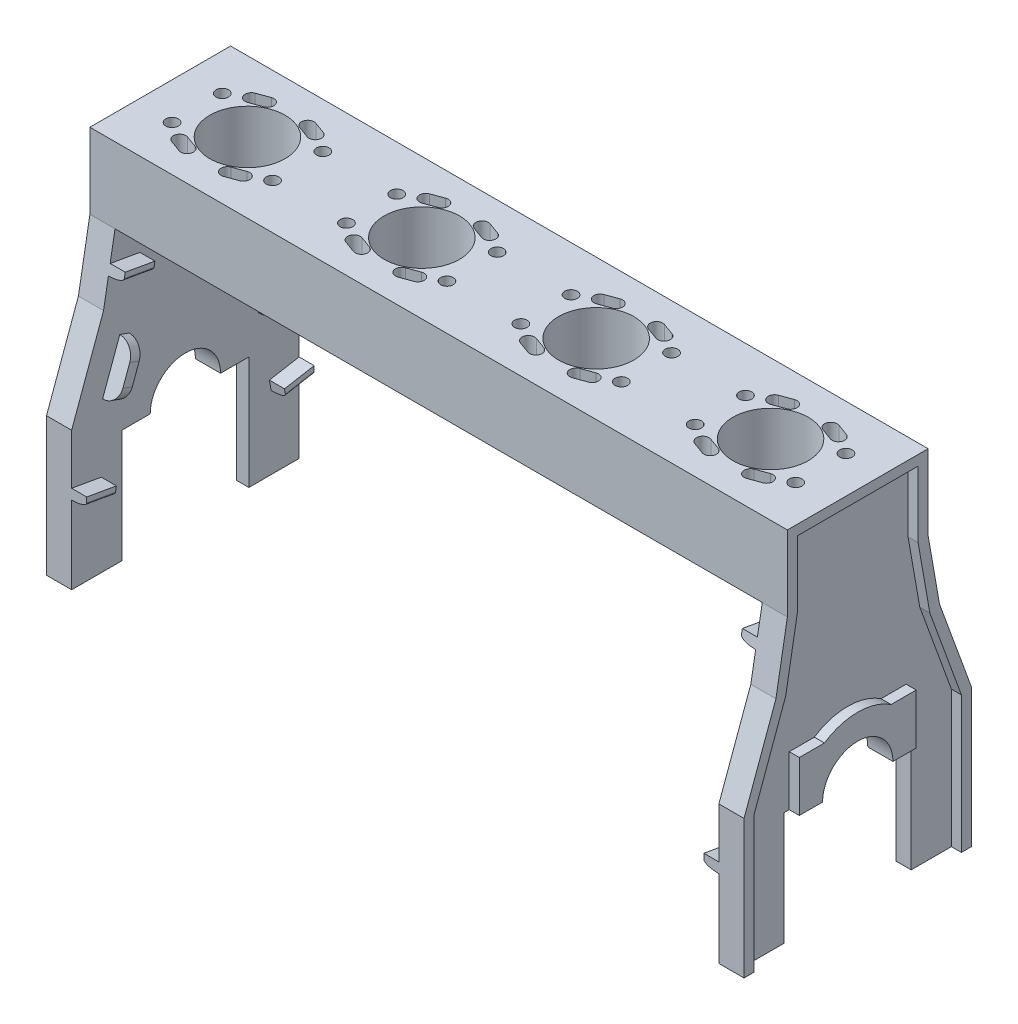
from build123d import *

# Parameters (mm, degrees)
SKETCH1_W           = 352.552
SKETCH1_H           = 71.12
SKETCH1_R           = 19.05
SKETCH1_R_2         = 3.175
BOSS_EXTRUDE1_DEPTH = 38.1
BOSS_EXTRUDE2_DEPTH = 12.7
CUT_EXTRUDE1_DEPTH  = 5.08
BOSS_EXTRUDE3_START = -12.7
BOSS_EXTRUDE3_DEPTH = 12.7
CUT_EXTRUDE4_START  = -6.35
CUT_EXTRUDE4_DEPTH  = 6.35
SKETCH7_R           = 3.175
CUT_EXTRUDE5_DEPTH  = 17.78
BOSS_EXTRUDE4_DEPTH = 7.62
BOSS_EXTRUDE5_DEPTH = 7.62
FILLET1_R           = 7.62
FILLET2_SIZE        = 7.62
FILLET2_SIZE_2      = 2.54


# Some blends are built 0.0001 mm under size
with BuildPart() as part:
    # Sketch1 → Boss-Extrude1 (new body)
    with BuildSketch(Plane(origin=(0, 0, 0), x_dir=(1, 0, 0), z_dir=(0, 1, 0))):
        with Locations((-132.207, 0)):
            Rectangle(SKETCH1_W, SKETCH1_H)
        with Locations(Location((0, 0, 0), (0, 0, 90))):
            Circle(SKETCH1_R, mode=Mode.SUBTRACT)
        with Locations(Location((-88.138, 0, 0), (0, 0, 90))):
            Circle(SKETCH1_R, mode=Mode.SUBTRACT)
        with Locations(Location((-176.276, 0, 0), (0, 0, 90))):
            Circle(SKETCH1_R, mode=Mode.SUBTRACT)
        with Locations(Location((-264.414, 0, 0), (0, 0, 90))):
            Circle(SKETCH1_R, mode=Mode.SUBTRACT)
        with Locations(Location((25.4, -12.7, 0), (0, 0, 90))):
            Circle(SKETCH1_R_2, mode=Mode.SUBTRACT)
        with Locations(Location((-25.4, -12.7, 0), (0, 0, 90))):
            Circle(SKETCH1_R_2, mode=Mode.SUBTRACT)
        with Locations(Location((25.4, 12.7, 0), (0, 0, 90))):
            Circle(SKETCH1_R_2, mode=Mode.SUBTRACT)
        with Locations(Location((-25.4, 12.7, 0), (0, 0, 90))):
            Circle(SKETCH1_R_2, mode=Mode.SUBTRACT)
        with Locations(Location((-113.538, 12.7, 0), (0, 0, 90))):
            Circle(SKETCH1_R_2, mode=Mode.SUBTRACT)
        with Locations(Location((-62.738, 12.7, 0), (0, 0, 90))):
            Circle(SKETCH1_R_2, mode=Mode.SUBTRACT)
        with Locations(Location((-113.538, -12.7, 0), (0, 0, 90))):
            Circle(SKETCH1_R_2, mode=Mode.SUBTRACT)
        with Locations(Location((-62.738, -12.7, 0), (0, 0, 90))):
            Circle(SKETCH1_R_2, mode=Mode.SUBTRACT)
        with Locations(Location((-201.676, 12.7, 0), (0, 0, 90))):
            Circle(SKETCH1_R_2, mode=Mode.SUBTRACT)
        with Locations(Location((-150.876, 12.7, 0), (0, 0, 90))):
            Circle(SKETCH1_R_2, mode=Mode.SUBTRACT)
        with Locations(Location((-201.676, -12.7, 0), (0, 0, 90))):
            Circle(SKETCH1_R_2, mode=Mode.SUBTRACT)
        with Locations(Location((-150.876, -12.7, 0), (0, 0, 90))):
            Circle(SKETCH1_R_2, mode=Mode.SUBTRACT)
        with Locations(Location((-289.814, 12.7, 0), (0, 0, 90))):
            Circle(SKETCH1_R_2, mode=Mode.SUBTRACT)
        with Locations(Location((-239.014, 12.7, 0), (0, 0, 90))):
            Circle(SKETCH1_R_2, mode=Mode.SUBTRACT)
        with Locations(Location((-289.814, -12.7, 0), (0, 0, 90))):
            Circle(SKETCH1_R_2, mode=Mode.SUBTRACT)
        with Locations(Location((-239.014, -12.7, 0), (0, 0, 90))):
            Circle(SKETCH1_R_2, mode=Mode.SUBTRACT)
        with BuildLine():
            Line((15.041134187, -15.164648019), (9.074086045, -17.336475929))
            ThreePointArc((9.074086045, -17.336475929), (7.176475929, -21.405913955), (11.245913955, -23.303524071))
            Line((11.245913955, -23.303524071), (17.212962097, -21.131696161))
            ThreePointArc((17.212962097, -21.131696161), (19.110572213, -17.062258135), (15.041134187, -15.164648019))
        make_face(mode=Mode.SUBTRACT)
        with BuildLine():
            Line((-17.212962097, -21.131696161), (-11.245913955, -23.303524071))
            ThreePointArc((-11.245913955, -23.303524071), (-7.176475929, -21.405913955), (-9.074086045, -17.336475929))
            Line((-9.074086045, -17.336475929), (-15.041134187, -15.164648019))
            ThreePointArc((-15.041134187, -15.164648019), (-19.110572213, -17.062258135), (-17.212962097, -21.131696161))
        make_face(mode=Mode.SUBTRACT)
        with BuildLine():
            Line((17.212962097, 21.131696161), (11.245913955, 23.303524071))
            ThreePointArc((11.245913955, 23.303524071), (7.176475929, 21.405913955), (9.074086045, 17.336475929))
            Line((9.074086045, 17.336475929), (15.041134187, 15.164648019))
            ThreePointArc((15.041134187, 15.164648019), (19.110572213, 17.062258135), (17.212962097, 21.131696161))
        make_face(mode=Mode.SUBTRACT)
        with BuildLine():
            Line((-15.041134187, 15.164648019), (-9.074086045, 17.336475929))
            ThreePointArc((-9.074086045, 17.336475929), (-7.176475929, 21.405913955), (-11.245913955, 23.303524071))
            Line((-11.245913955, 23.303524071), (-17.212962097, 21.131696161))
            ThreePointArc((-17.212962097, 21.131696161), (-19.110572213, 17.062258135), (-15.041134187, 15.164648019))
        make_face(mode=Mode.SUBTRACT)
        with BuildLine():
            Line((-103.179134187, 15.164648019), (-97.212086045, 17.336475929))
            ThreePointArc((-97.212086045, 17.336475929), (-95.314475929, 21.405913955), (-99.383913955, 23.303524071))
            Line((-99.383913955, 23.303524071), (-105.350962097, 21.131696161))
            ThreePointArc((-105.350962097, 21.131696161), (-107.248572213, 17.062258135), (-103.179134187, 15.164648019))
        make_face(mode=Mode.SUBTRACT)
        with BuildLine():
            Line((-70.925037903, 21.131696161), (-76.892086045, 23.303524071))
            ThreePointArc((-76.892086045, 23.303524071), (-80.961524071, 21.405913955), (-79.063913955, 17.336475929))
            Line((-79.063913955, 17.336475929), (-73.096865813, 15.164648019))
            ThreePointArc((-73.096865813, 15.164648019), (-69.027427787, 17.062258135), (-70.925037903, 21.131696161))
        make_face(mode=Mode.SUBTRACT)
        with BuildLine():
            Line((-105.350962097, -21.131696161), (-99.383913955, -23.303524071))
            ThreePointArc((-99.383913955, -23.303524071), (-95.314475929, -21.405913955), (-97.212086045, -17.336475929))
            Line((-97.212086045, -17.336475929), (-103.179134187, -15.164648019))
            ThreePointArc((-103.179134187, -15.164648019), (-107.248572213, -17.062258135), (-105.350962097, -21.131696161))
        make_face(mode=Mode.SUBTRACT)
        with BuildLine():
            Line((-73.096865813, -15.164648019), (-79.063913955, -17.336475929))
            ThreePointArc((-79.063913955, -17.336475929), (-80.961524071, -21.405913955), (-76.892086045, -23.303524071))
            Line((-76.892086045, -23.303524071), (-70.925037903, -21.131696161))
            ThreePointArc((-70.925037903, -21.131696161), (-69.027427787, -17.062258135), (-73.096865813, -15.164648019))
        make_face(mode=Mode.SUBTRACT)
        with BuildLine():
            Line((-191.317134187, 15.164648019), (-185.350086045, 17.336475929))
            ThreePointArc((-185.350086045, 17.336475929), (-183.452475929, 21.405913955), (-187.521913955, 23.303524071))
            Line((-187.521913955, 23.303524071), (-193.488962097, 21.131696161))
            ThreePointArc((-193.488962097, 21.131696161), (-195.386572213, 17.062258135), (-191.317134187, 15.164648019))
        make_face(mode=Mode.SUBTRACT)
        with BuildLine():
            Line((-159.063037903, 21.131696161), (-165.030086045, 23.303524071))
            ThreePointArc((-165.030086045, 23.303524071), (-169.099524071, 21.405913955), (-167.201913955, 17.336475929))
            Line((-167.201913955, 17.336475929), (-161.234865813, 15.164648019))
            ThreePointArc((-161.234865813, 15.164648019), (-157.165427787, 17.062258135), (-159.063037903, 21.131696161))
        make_face(mode=Mode.SUBTRACT)
        with BuildLine():
            Line((-193.488962097, -21.131696161), (-187.521913955, -23.303524071))
            ThreePointArc((-187.521913955, -23.303524071), (-183.452475929, -21.405913955), (-185.350086045, -17.336475929))
            Line((-185.350086045, -17.336475929), (-191.317134187, -15.164648019))
            ThreePointArc((-191.317134187, -15.164648019), (-195.386572213, -17.062258135), (-193.488962097, -21.131696161))
        make_face(mode=Mode.SUBTRACT)
        with BuildLine():
            Line((-161.234865813, -15.164648019), (-167.201913955, -17.336475929))
            ThreePointArc((-167.201913955, -17.336475929), (-169.099524071, -21.405913955), (-165.030086045, -23.303524071))
            Line((-165.030086045, -23.303524071), (-159.063037903, -21.131696161))
            ThreePointArc((-159.063037903, -21.131696161), (-157.165427787, -17.062258135), (-161.234865813, -15.164648019))
        make_face(mode=Mode.SUBTRACT)
        with BuildLine():
            Line((-279.455134187, 15.164648019), (-273.488086045, 17.336475929))
            ThreePointArc((-273.488086045, 17.336475929), (-271.590475929, 21.405913955), (-275.659913955, 23.303524071))
            Line((-275.659913955, 23.303524071), (-281.626962097, 21.131696161))
            ThreePointArc((-281.626962097, 21.131696161), (-283.524572213, 17.062258135), (-279.455134187, 15.164648019))
        make_face(mode=Mode.SUBTRACT)
        with BuildLine():
            Line((-247.201037903, 21.131696161), (-253.168086045, 23.303524071))
            ThreePointArc((-253.168086045, 23.303524071), (-257.237524071, 21.405913955), (-255.339913955, 17.336475929))
            Line((-255.339913955, 17.336475929), (-249.372865813, 15.164648019))
            ThreePointArc((-249.372865813, 15.164648019), (-245.303427787, 17.062258135), (-247.201037903, 21.131696161))
        make_face(mode=Mode.SUBTRACT)
        with BuildLine():
            Line((-281.626962097, -21.131696161), (-275.659913955, -23.303524071))
            ThreePointArc((-275.659913955, -23.303524071), (-271.590475929, -21.405913955), (-273.488086045, -17.336475929))
            Line((-273.488086045, -17.336475929), (-279.455134187, -15.164648019))
            ThreePointArc((-279.455134187, -15.164648019), (-283.524572213, -17.062258135), (-281.626962097, -21.131696161))
        make_face(mode=Mode.SUBTRACT)
        with BuildLine():
            Line((-249.372865813, -15.164648019), (-255.339913955, -17.336475929))
            ThreePointArc((-255.339913955, -17.336475929), (-257.237524071, -21.405913955), (-253.168086045, -23.303524071))
            Line((-253.168086045, -23.303524071), (-247.201037903, -21.131696161))
            ThreePointArc((-247.201037903, -21.131696161), (-245.303427787, -17.062258135), (-249.372865813, -15.164648019))
        make_face(mode=Mode.SUBTRACT)
    extrude(amount=BOSS_EXTRUDE1_DEPTH)

    # Sketch2 → Boss-Extrude2 (add)
    with BuildSketch(Plane(origin=(44.069, 0, 0), x_dir=(0, 0, -1), z_dir=(1, 0, 0))):
        with BuildLine():
            Line((-35.56, 0), (-41.363421039, -32.91283623))
            Line((-41.363421039, -32.91283623), (-57.488453935, -77.216))
            Line((-57.488453935, -77.216), (-57.488453935, -147.066))
            Line((-57.488453935, -147.066), (-32.088453935, -147.066))
            Line((-32.088453935, -147.066), (-32.088453935, -89.916))
            Line((-32.088453935, -89.916), (-17.78, -89.916))
            ThreePointArc((-17.78, -89.916), (0, -72.136), (17.78, -89.916))
            Line((17.78, -89.916), (32.088453935, -89.916))
            Line((32.088453935, -89.916), (32.088453935, -147.066))
            Line((32.088453935, -147.066), (57.488453935, -147.066))
            Line((57.488453935, -147.066), (57.488453935, -77.216))
            Line((57.488453935, -77.216), (41.363421039, -32.91283623))
            Line((41.363421039, -32.91283623), (35.56, 0))
            Line((35.56, 0), (-35.56, 0))
        make_face()
    extrude(amount=-BOSS_EXTRUDE2_DEPTH)

    # Sketch3 → Cut-Extrude1 (cut)
    with BuildSketch(Plane(origin=(44.069, 0, 0), x_dir=(0, 0, -1), z_dir=(1, 0, 0))):
        with BuildLine():
            Line((-29.548453935, -64.516), (-16.848453935, -64.516))
            ThreePointArc((-16.848453935, -64.516), (0, -59.436), (16.848453935, -64.516))
            Line((16.848453935, -64.516), (29.548453935, -64.516))
            Line((29.548453935, -64.516), (29.548453935, -89.916))
            Line((29.548453935, -89.916), (32.088453935, -89.916))
            Line((32.088453935, -89.916), (32.088453935, -147.066))
            Line((32.088453935, -147.066), (52.408453935, -147.066))
            Line((52.408453935, -147.066), (52.408453935, -78.111741062))
            Line((52.408453935, -78.111741062), (36.437774268, -34.232659305))
            Line((36.437774268, -34.232659305), (30.48, -0.444442411))
            Line((30.48, -0.444442411), (30.48, 33.02))
            Line((30.48, 33.02), (-30.48, 33.02))
            Line((-30.48, 33.02), (-30.48, -0.444442411))
            Line((-30.48, -0.444442411), (-36.437774268, -34.232659305))
            Line((-36.437774268, -34.232659305), (-52.408453935, -78.111741062))
            Line((-52.408453935, -78.111741062), (-52.408453935, -147.066))
            Line((-52.408453935, -147.066), (-32.088453935, -147.066))
            Line((-32.088453935, -147.066), (-32.088453935, -89.916))
            Line((-32.088453935, -89.916), (-29.548453935, -89.916))
            Line((-29.548453935, -89.916), (-29.548453935, -64.516))
        make_face()
    extrude(amount=-CUT_EXTRUDE1_DEPTH, mode=Mode.SUBTRACT)

    # Sketch5 → Boss-Extrude3 (add)
    with BuildSketch(Plane.ZY.offset(308.483).offset(BOSS_EXTRUDE3_START)):
        with BuildLine():
            Line((17.78, -89.916), (32.088453935, -89.916))
            Line((32.088453935, -89.916), (32.088453935, -147.066))
            Line((32.088453935, -147.066), (57.488453935, -147.066))
            Line((57.488453935, -147.066), (57.488453935, -77.216))
            Line((57.488453935, -77.216), (41.363421039, -32.91283623))
            Line((41.363421039, -32.91283623), (35.56, 0))
            Line((35.56, 0), (-35.56, 0))
            Line((-35.56, 0), (-41.363421039, -32.91283623))
            Line((-41.363421039, -32.91283623), (-57.488453935, -77.216))
            Line((-57.488453935, -77.216), (-57.488453935, -147.066))
            Line((-57.488453935, -147.066), (-32.088453935, -147.066))
            Line((-32.088453935, -147.066), (-32.088453935, -89.916))
            Line((-32.088453935, -89.916), (-17.78, -89.916))
            ThreePointArc((-17.78, -89.916), (0, -72.136), (17.78, -89.916))
        make_face()
    extrude(amount=BOSS_EXTRUDE3_DEPTH)

    # Sketch6 → Cut-Extrude4 (cut)
    with BuildSketch(Plane.ZY.offset(308.483).offset(CUT_EXTRUDE4_START)):
        with BuildLine():
            Line((29.548453935, -64.516), (29.548453935, -89.916))
            Line((29.548453935, -89.916), (32.088453935, -89.916))
            Line((32.088453935, -89.916), (32.088453935, -147.066))
            Line((32.088453935, -147.066), (52.408453935, -147.066))
            Line((52.408453935, -147.066), (52.408453935, -78.111741062))
            Line((52.408453935, -78.111741062), (36.437774268, -34.232659305))
            Line((36.437774268, -34.232659305), (30.48, -0.444442411))
            Line((30.48, -0.444442411), (30.48, 33.02))
            Line((30.48, 33.02), (-30.48, 33.02))
            Line((-30.48, 33.02), (-30.48, -0.444442411))
            Line((-30.48, -0.444442411), (-36.437774268, -34.232659305))
            Line((-36.437774268, -34.232659305), (-52.408453935, -78.111741062))
            Line((-52.408453935, -78.111741062), (-52.408453935, -147.066))
            Line((-52.408453935, -147.066), (-32.088453935, -147.066))
            Line((-32.088453935, -147.066), (-32.088453935, -89.916))
            Line((-32.088453935, -89.916), (-29.548453935, -89.916))
            Line((-29.548453935, -89.916), (-29.548453935, -64.516))
            Line((-29.548453935, -64.516), (-16.848453935, -64.516))
            ThreePointArc((-16.848453935, -64.516), (0, -59.436), (16.848453935, -64.516))
            Line((16.848453935, -64.516), (29.548453935, -64.516))
        make_face()
    extrude(amount=CUT_EXTRUDE4_DEPTH, mode=Mode.SUBTRACT)

    # Sketch7 → Cut-Extrude5 (cut)
    with BuildSketch(Plane.XZ.offset(89.916)):
        with Locations(Location((37.719, 23.198453935, 0), (0, 0, 270))):
            Circle(SKETCH7_R)
        with Locations(Location((37.719, -23.198453935, 0), (0, 0, 270))):
            Circle(SKETCH7_R)
        with Locations(Location((-302.133, -23.198453935, 0), (0, 0, 270))):
            Circle(SKETCH7_R)
        with Locations(Location((-302.133, 23.198453935, 0), (0, 0, 270))):
            Circle(SKETCH7_R)
    extrude(amount=-CUT_EXTRUDE5_DEPTH, mode=Mode.SUBTRACT)

    # Sketch8 → Boss-Extrude4 (add)
    with BuildSketch(Plane.ZY.offset(-31.369)):
        Polygon((-38.020644148, -13.955006423), (-38.902776891, -18.957829808), (-23.894306735, -21.604228036), (-23.012173992, -16.60140465), align=None)
        Polygon((-57.488453935, -107.774367188), (-43.362116522, -110.265221613), (-42.479983779, -105.262398228), (-57.488453935, -102.616), align=None)
        Polygon((-33.148185383, -47.473977651), (-41.835497023, -71.342170219), (-37.06185851, -73.079632548), (-28.374546869, -49.21143998), align=None)
        Polygon((28.374546869, -49.21143998), (33.148185383, -47.473977651), (41.835497023, -71.342170219), (37.06185851, -73.079632548), align=None)
        Polygon((42.479983779, -105.262398228), (43.362116522, -110.265221613), (57.488453935, -107.774367188), (57.488453935, -102.616), align=None)
        Polygon((23.012173992, -16.60140465), (38.020644148, -13.955006423), (38.902776891, -18.957829808), (23.894306735, -21.604228036), align=None)
    extrude(amount=BOSS_EXTRUDE4_DEPTH)

    # Sketch9 → Boss-Extrude5 (add)
    with BuildSketch(Plane(origin=(-295.783, 0, 0), x_dir=(0, 0, -1), z_dir=(1, 0, 0))):
        Polygon((43.362116522, -110.265221613), (57.488453935, -107.774367188), (57.488453935, -102.616), (42.479983779, -105.262398228), align=None)
        Polygon((38.902776891, -18.957829808), (38.020644148, -13.955006423), (23.012173992, -16.60140465), (23.894306735, -21.604228036), align=None)
        Polygon((41.835497023, -71.342170219), (33.148185383, -47.473977651), (28.374546869, -49.21143998), (37.06185851, -73.079632548), align=None)
        Polygon((-23.012173992, -16.60140465), (-38.020644148, -13.955006423), (-38.902776891, -18.957829808), (-23.894306735, -21.604228036), align=None)
        Polygon((-43.362116522, -110.265221613), (-42.479983779, -105.262398228), (-57.488453935, -102.616), (-57.488453935, -107.774367188), align=None)
        Polygon((-28.374546869, -49.21143998), (-33.148185383, -47.473977651), (-41.835497023, -71.342170219), (-37.06185851, -73.079632548), align=None)
    extrude(amount=BOSS_EXTRUDE5_DEPTH)

    # Fillet1
    fillet1_edges = [part.edges().sort_by_distance(p)[0] for p in [
        (23.749, -72.210901383, 39.448677766),
        (23.749, -48.342708816, 30.761366126),
        (23.749, -72.210901383, -39.448677766),
        (23.749, -48.342708816, -30.761366126),
        (-288.163, -72.210901383, 39.448677766),
        (-288.163, -48.342708816, 30.761366126),
        (-288.163, -72.210901383, -39.448677766),
        (-288.163, -48.342708816, -30.761366126),
    ]]
    fillet(fillet1_edges, radius=FILLET1_R - 0.0001)  # a hair under: the kernel refuses the full size

    # Fillet2
    # an asymmetric fillet: 7.62, 2.54 mm, written as the material it takes off along each edge
    with BuildSketch(Plane(origin=(-288.163, -24.91222582, -5.13371904), x_dir=(-1, 0, 0), z_dir=(0, 0.17364817766693266, -0.9848077530122077)), Plane(origin=(-288.163, -15.649832023, 57.663364586), x_dir=(-1, 0, 0), z_dir=(0, -0.17364817766693263, -0.9848077530122077)), Plane(origin=(23.749, -15.649832023, -57.663364586), x_dir=(1, 0, 0), z_dir=(0, -0.17364817766693266, 0.9848077530122077))) as fillet2_piece_1:
        with BuildLine():
            Bezier((FILLET2_SIZE, 0), (0, 0), (0, FILLET2_SIZE_2), weights=[1, 0.707106781, 1])
            Line((0, FILLET2_SIZE_2), (0, 0))
            Line((0, 0), (FILLET2_SIZE, 0))
        make_face()
    extrude(amount=53.34, mode=Mode.SUBTRACT)
    with BuildSketch(Plane(origin=(-288.163, -113.573219397, -24.601528827), x_dir=(-1, 0, 0), z_dir=(0, 0.17364817766693388, -0.9848077530122075)), Plane(origin=(-288.163, -104.466369404, 76.24904163), x_dir=(-1, 0, 0), z_dir=(0, -0.17364817766693388, -0.9848077530122075)), Plane(origin=(23.749, -113.573219397, 24.601528827), x_dir=(1, 0, 0), z_dir=(0, 0.17364817766693388, 0.9848077530122075)), Plane(origin=(23.749, -104.466369404, -76.24904163), x_dir=(1, 0, 0), z_dir=(0, -0.17364817766693388, 0.9848077530122075))) as fillet2_piece_2:
        with BuildLine():
            Bezier((FILLET2_SIZE, 0), (0, 0), (0, FILLET2_SIZE_2), weights=[1, 0.707106781, 1])
            Line((0, FILLET2_SIZE_2), (0, 0))
            Line((0, 0), (FILLET2_SIZE, 0))
        make_face()
    extrude(amount=52.444258938, mode=Mode.SUBTRACT)
    with BuildSketch(Plane(origin=(23.749, -15.649832023, 57.663364586), x_dir=(1, 0, 0), z_dir=(0, -0.17364817766693266, -0.9848077530122077))) as fillet2_piece_3:
        with BuildLine():
            Bezier((FILLET2_SIZE, 0), (0, 0), (0, -FILLET2_SIZE_2), weights=[1, 0.707106781, 1])
            Line((0, -FILLET2_SIZE_2), (0, 0))
            Line((0, 0), (FILLET2_SIZE, 0))
        make_face()
    extrude(amount=53.34, mode=Mode.SUBTRACT)


solid = part.part
